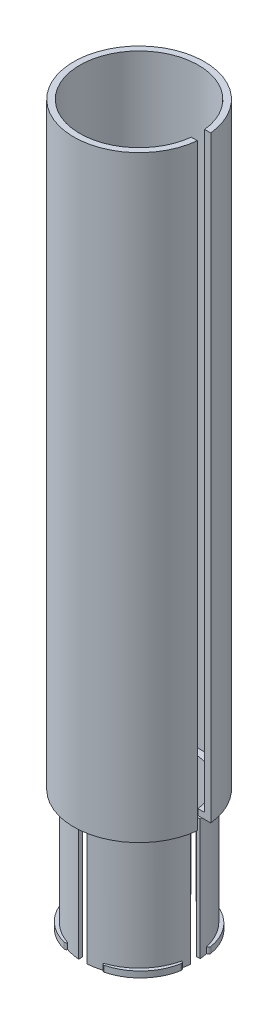
from build123d import *

# Parameters (mm, degrees)
SKETCH1_R           = 21.59
BOSS_EXTRUDE1_DEPTH = 200
SHELL1_T            = 2
CUT_EXTRUDE1_START  = 20
CUT_EXTRUDE1_DEPTH  = 5
SKETCH4_R           = 18.651037357
BOSS_EXTRUDE2_DEPTH = 40
SKETCH7_R           = 17.409680213
CUT_EXTRUDE4_DEPTH  = 62
SKETCH8_W           = 2.785852998
SKETCH8_H           = 5.87658936
SKETCH8_W_2         = 8.878050256
SKETCH8_H_2         = 3.207420782
SKETCH8_W_3         = 2.758641046
SKETCH8_H_3         = 8.505589864
CUT_EXTRUDE5_DEPTH  = 203.317216766
BOSS_EXTRUDE4_DEPTH = 2
SKETCH10_R          = 21.59
CUT_EXTRUDE7_DEPTH  = 2.5


with BuildPart() as part:
    # Sketch1 → Boss-Extrude1 (new body)
    with BuildSketch(Plane(origin=(0, 0, 0), x_dir=(1, 0, 0), z_dir=(0, 1, 0))):
        Circle(SKETCH1_R)
    extrude(amount=BOSS_EXTRUDE1_DEPTH)

    # Shell1 (no face opened: a closed hollow body)
    add(offset(amount=-SHELL1_T, mode=Mode.PRIVATE), mode=Mode.SUBTRACT)

    # Sketch2 → Cut-Extrude1 (cut, symmetric)
    with BuildSketch(Plane(origin=(0, 0, 0), x_dir=(0, 0, -1), z_dir=(1, 0, 0)).offset(CUT_EXTRUDE1_START)):
        Polygon((2.213988381, 104.269834735), (2.213988381, 0), (-2.213988381, 0), (-2.213988381, 104.269834735), (-2.213988381, 199.79439609), (2.213988381, 199.79439609), align=None)
    extrude(amount=CUT_EXTRUDE1_DEPTH, both=True, mode=Mode.SUBTRACT)

    # Sketch4 → Boss-Extrude2 (add)
    with BuildSketch(Plane.XZ):
        Circle(SKETCH4_R)
    extrude(amount=BOSS_EXTRUDE2_DEPTH)

    # Sketch7 → Cut-Extrude4 (cut)
    with BuildSketch(Plane(origin=(0, -40, 0), x_dir=(-1, 0, 0), z_dir=(0, -1, 0))):
        Circle(SKETCH7_R)
    extrude(amount=-CUT_EXTRUDE4_DEPTH, mode=Mode.SUBTRACT)

    # Sketch8 → Cut-Extrude5 (cut, through all)
    with BuildSketch(Plane(origin=(0, 0, 0), x_dir=(1, 0, 0), z_dir=(0, 1, 0))):
        with Locations((0, 20.108138302)):
            Rectangle(SKETCH8_W, SKETCH8_H)
        with Locations((18.709836445, -0.001004202)):
            Rectangle(SKETCH8_W_2, SKETCH8_H_2)
        with Locations((0.013605976, -18.452209414)):
            Rectangle(SKETCH8_W_3, SKETCH8_H_3)
        with Locations((-18.709836445, -0.001004202)):
            Rectangle(SKETCH8_W_2, SKETCH8_H_2)
    extrude(amount=-CUT_EXTRUDE5_DEPTH, mode=Mode.SUBTRACT)

    # Sketch9 → Boss-Extrude4 (add)
    with BuildSketch(Plane.XZ.offset(40)):
        with BuildLine():
            ThreePointArc((18.832779949, 4.924358061), (14.708668429, 13.306015403), (6.695933374, 18.107739321))
            ThreePointArc((6.695933374, 18.107739321), (5.893480657, 17.635029705), (6.366190274, 16.832576988))
            ThreePointArc((6.366190274, 16.832576988), (13.739666938, 12.413936035), (17.534755611, 4.700969813))
            ThreePointArc((17.534755611, 4.700969813), (18.295461904, 4.163651768), (18.832779949, 4.924358061))
        make_face()
        with BuildLine():
            ThreePointArc((18.832779949, -4.924358061), (14.708668429, -13.306015403), (6.695933374, -18.107739321))
            ThreePointArc((6.695933374, -18.107739321), (5.893480657, -17.635029705), (6.366190274, -16.832576988))
            ThreePointArc((6.366190274, -16.832576988), (13.739666938, -12.413936035), (17.534755611, -4.700969813))
            ThreePointArc((17.534755611, -4.700969813), (18.295461904, -4.163651768), (18.832779949, -4.924358061))
        make_face()
        with BuildLine():
            ThreePointArc((-18.832779949, -4.924358061), (-14.708668429, -13.306015403), (-6.695933374, -18.107739321))
            ThreePointArc((-6.695933374, -18.107739321), (-5.893480657, -17.635029705), (-6.366190274, -16.832576988))
            ThreePointArc((-6.366190274, -16.832576988), (-13.739666938, -12.413936035), (-17.534755611, -4.700969813))
            ThreePointArc((-17.534755611, -4.700969813), (-18.295461904, -4.163651768), (-18.832779949, -4.924358061))
        make_face()
        with BuildLine():
            ThreePointArc((-18.832779949, 4.924358061), (-14.708668429, 13.306015403), (-6.695933374, 18.107739321))
            ThreePointArc((-6.695933374, 18.107739321), (-5.893480657, 17.635029705), (-6.366190274, 16.832576988))
            ThreePointArc((-6.366190274, 16.832576988), (-13.739666938, 12.413936035), (-17.534755611, 4.700969813))
            ThreePointArc((-17.534755611, 4.700969813), (-18.295461904, 4.163651768), (-18.832779949, 4.924358061))
        make_face()
    extrude(amount=-BOSS_EXTRUDE4_DEPTH)

    # Sketch10 → Cut-Extrude7 (cut, symmetric)
    with BuildSketch(Plane(origin=(0, 200, 0), x_dir=(1, 0, 0), z_dir=(0, 1, 0))):
        Circle(SKETCH10_R)
    extrude(amount=CUT_EXTRUDE7_DEPTH, both=True, mode=Mode.SUBTRACT)


solid = part.part
